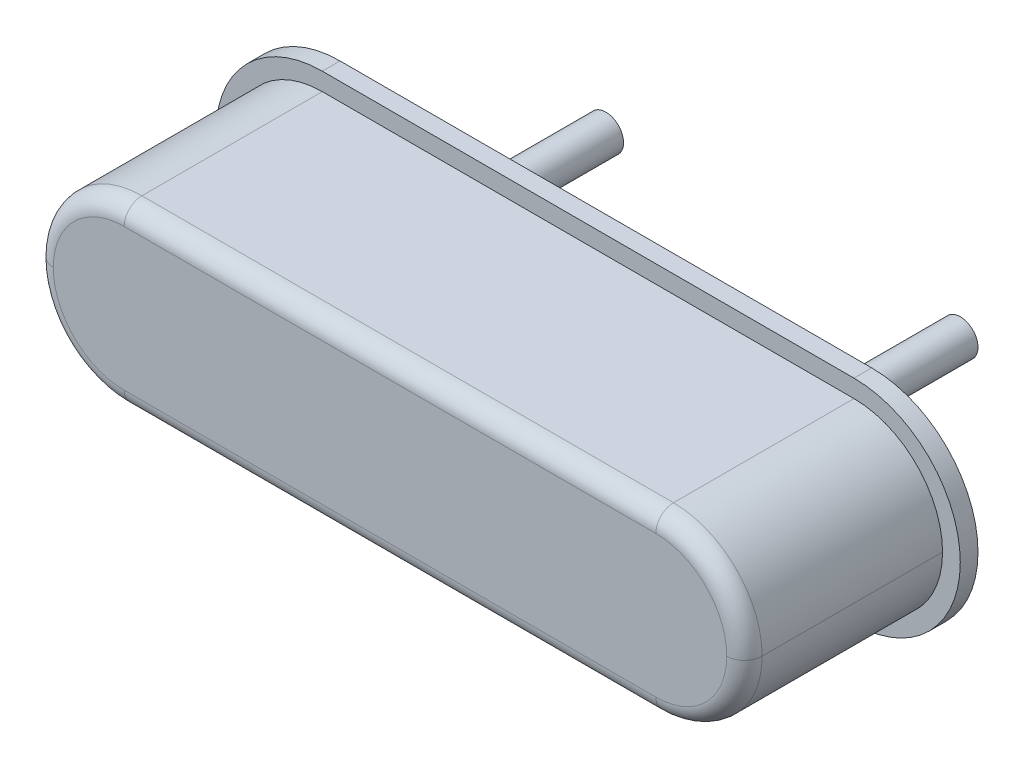
from build123d import *

# Parameters (mm, degrees)
SKETCH2_R           = 0.254
SKETCH4_W           = 10.16
SKETCH4_H           = 3.093614779
BOSS_EXTRUDE1_DEPTH = 1.27
FILLET1_R           = 1.27
FILLET2_R           = 0.254
BOSS_EXTRUDE2_DEPTH = 0.254


with BuildPart() as part:
    # Base-Sweep: sweep along a path in Sketch1
    with BuildLine(Plane(origin=(0, 0, 0), x_dir=(1, 0, 0), z_dir=(0, 1, 0))) as base_sweep_path:
        Line((0, 2.54), (0, -0.508))
    # Sketch2 → Base-Sweep (sweep)
    with BuildSketch(Plane.XY.offset(-2.54)):
        Circle(SKETCH2_R)
    base_sweep = sweep(path=base_sweep_path.line)

    # Sketch4 → Boss-Extrude1 (add, symmetric)
    with BuildSketch(Plane(origin=(0, 0, 0), x_dir=(1, 0, 0), z_dir=(0, 1, 0))):
        with Locations((2.54, -1.54680739)):
            Rectangle(SKETCH4_W, SKETCH4_H)
    extrude(amount=BOSS_EXTRUDE1_DEPTH, both=True)

    # Fillet1
    fillet1_edges = [part.edges().sort_by_distance(p)[0] for p in [
        (-2.54, -1.27, 1.546807389),
        (7.62, -1.27, 1.546807389),
        (-2.54, 1.27, 1.546807389),
        (7.62, 1.27, 1.546807389),
    ]]
    fillet(fillet1_edges, radius=FILLET1_R - 0.0001)  # a hair under: the kernel refuses the full size

    # Fillet2
    fillet2_edges = [part.edges().sort_by_distance(p)[0] for p in [
        (2.54, -1.27, 3.093614779),
        (2.54, 1.27, 3.093614779),
        (7.248054901, 0.898054901, 3.093614779),
        (7.248054901, -0.898054901, 3.093614779),
        (-2.168054901, 0.898054901, 3.093614779),
        (-2.168054901, -0.898054901, 3.093614779),
    ]]
    fillet(fillet2_edges, radius=FILLET2_R)

    # Mirror5: Base-Sweep across plane
    add(base_sweep.mirror(Plane(origin=(2.54, 0, 0), x_dir=(0, 0, 1), z_dir=(1, 0, 0))))

    # Sketch6 → Boss-Extrude2 (add)
    with BuildSketch(Plane(origin=(0, 0, 0), x_dir=(-1, 0, 0), z_dir=(0, 0, -1))):
        with BuildLine():
            Line((-6.35, -1.524), (1.27, -1.524))
            ThreePointArc((1.27, -1.524), (2.347630735, -1.077630735), (2.794, 0))
            ThreePointArc((2.794, 0), (2.347630735, 1.077630735), (1.27, 1.524))
            Line((1.27, 1.524), (-6.35, 1.524))
            ThreePointArc((-6.35, 1.524), (-7.427630735, 1.077630735), (-7.874, 0))
            ThreePointArc((-7.874, 0), (-7.427630735, -1.077630735), (-6.35, -1.524))
        make_face()
    extrude(amount=-BOSS_EXTRUDE2_DEPTH)


solid = part.part
